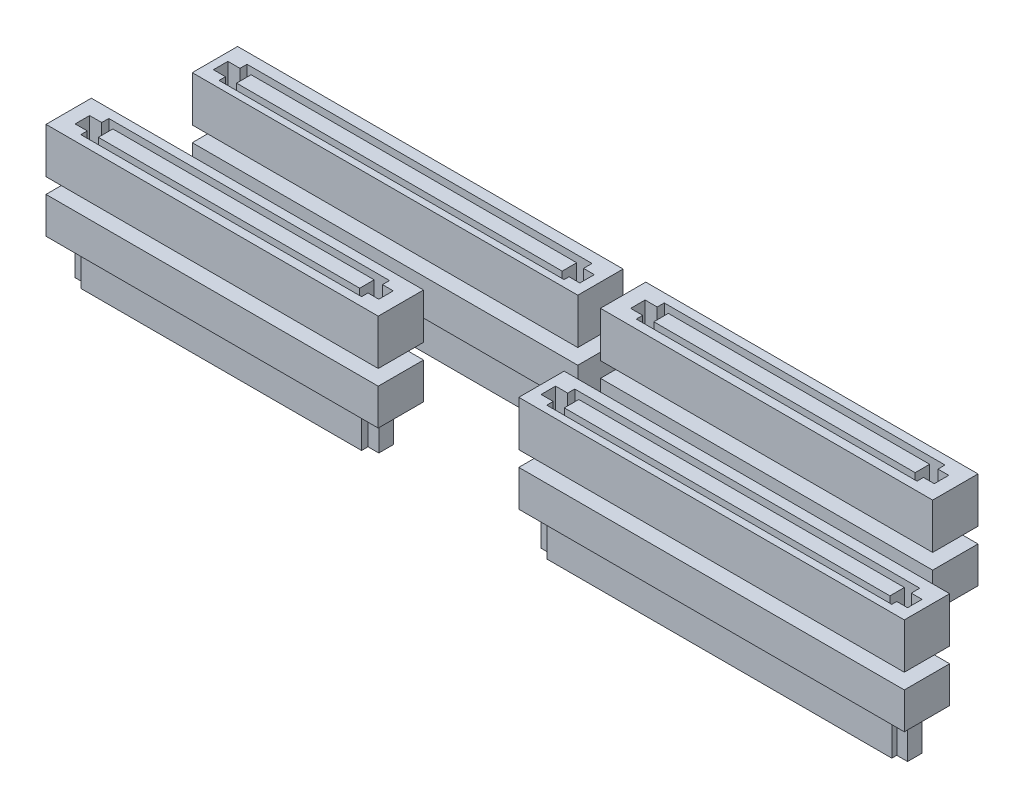
from build123d import *

# Parameters (mm, degrees)
SKETCH1_W          = 42.5
SKETCH1_H          = 5
SV4_DEPTH          = 5
SKETCH1_W_2        = 36.625
SV4_2_DEPTH        = 5
SV4_3_DEPTH        = 5
SV4_4_DEPTH        = 5
SKETCH3_W          = 28.811718275
SKETCH3_H          = 1.597828601
SKETCH3_W_2        = 35.897762959
SKETCH3_W_3        = 35.897762958
CUT_EXTRUDE1_DEPTH = 4
SKETCH6_W          = 42.5
SKETCH6_H          = 5
SV_A_DEPTH         = 4
SKETCH6_W_2        = 36.625
SV_A_2_DEPTH       = 4
SV_A_3_DEPTH       = 4
SV_A_4_DEPTH       = 4
SKETCH7_W          = 35.897762958
SKETCH7_H          = 1.597828601
SKETCH7_W_2        = 28.811718275
SKETCH7_W_3        = 35.897762959
SV_B_DEPTH         = 4


with BuildPart() as part:
    # Sketch1 → SV4 (new body)
    with BuildSketch(Plane(origin=(0, 0, 0), x_dir=(1, 0, 0), z_dir=(0, 1, 0))):
        with Locations((76, 7)):
            Rectangle(SKETCH1_W, SKETCH1_H)
    extrude(amount=SV4_DEPTH)


with BuildPart() as body_2:
    # Sketch1 → SV4 2 (new body)
    with BuildSketch(Plane(origin=(0, 0, 0), x_dir=(1, 0, 0), z_dir=(0, 1, 0))):
        with Locations((20.9375, 7)):
            Rectangle(SKETCH1_W_2, SKETCH1_H)
    extrude(amount=SV4_2_DEPTH)


with BuildPart() as body_3:
    # Sketch1 → SV4 3 (new body)
    with BuildSketch(Plane(origin=(0, 0, 0), x_dir=(1, 0, 0), z_dir=(0, 1, 0))):
        with Locations((69.0625, 20)):
            Rectangle(SKETCH1_W_2, SKETCH1_H)
    extrude(amount=SV4_3_DEPTH)


with BuildPart() as body_4:
    # Sketch1 → SV4 4 (new body)
    with BuildSketch(Plane(origin=(0, 0, 0), x_dir=(1, 0, 0), z_dir=(0, 1, 0))):
        with Locations((27, 20)):
            Rectangle(SKETCH1_W, SKETCH1_H)
    extrude(amount=SV4_4_DEPTH)


with BuildPart() as cut_extrude1_tool:
    # Sketch3 → Cut-Extrude1 (new body)
    # profile 1 of 4: a face of its own
    with BuildSketch(Plane(origin=(0, 5, 0), x_dir=(1, 0, 0), z_dir=(0, 1, 0))):
        Polygon((4.189336253, 7.745735487), (5.524337048, 7.745735487), (5.524337048, 8.524173538), (36.475691419, 8.524173538), (36.475691419, 7.745735487), (37.666991912, 7.745735487), (37.666991912, 6.147906886), (36.475691419, 6.147906886), (36.475691419, 5.438560322), (5.524337048, 5.438560322), (5.524337048, 6.147906886), (4.189336253, 6.147906886), align=None)
        with Locations((21.152985591, 6.946821187)):
            Rectangle(SKETCH3_W, SKETCH3_H, mode=Mode.SUBTRACT)
    # profile 2 of 4: a face of its own
    with BuildSketch(Plane(origin=(0, 5, 0), x_dir=(1, 0, 0), z_dir=(0, 1, 0))):
        Polygon((52.421116037, 20.753597434), (53.756116831, 20.753597434), (53.756116831, 21.532035485), (84.707471203, 21.532035485), (84.707471203, 20.753597434), (85.898771695, 20.753597434), (85.898771695, 19.155768833), (84.707471203, 19.155768833), (84.707471203, 18.446422269), (53.756116831, 18.446422269), (53.756116831, 19.155768833), (52.421116037, 19.155768833), align=None)
        with Locations((69.384765375, 19.954683133)):
            Rectangle(SKETCH3_W, SKETCH3_H, mode=Mode.SUBTRACT)
    # profile 3 of 4: a face of its own
    with BuildSketch(Plane(origin=(0, 5, 0), x_dir=(1, 0, 0), z_dir=(0, 1, 0))):
        Polygon((55.705906871, 7.599031898), (57.040907666, 7.599031898), (57.040907666, 8.377469948), (95.07830672, 8.377469948), (95.07830672, 7.437727621), (96.269607213, 7.437727621), (96.269607213, 5.83989902), (95.07830672, 5.83989902), (95.07830672, 5.291856733), (57.040907666, 5.291856733), (57.040907666, 6.001203297), (55.705906871, 6.001203297), align=None)
        with Locations((76.21257855, 6.800117597)):
            Rectangle(SKETCH3_W_2, SKETCH3_H, mode=Mode.SUBTRACT)
    # profile 4 of 4: a face of its own
    with BuildSketch(Plane(origin=(0, 5, 0), x_dir=(1, 0, 0), z_dir=(0, 1, 0))):
        Polygon((6.636601859, 20.53972103), (7.971602653, 20.53972103), (7.971602653, 21.318159081), (46.009001708, 21.318159081), (46.009001708, 20.378416754), (47.2003022, 20.378416754), (47.2003022, 18.780588153), (46.009001708, 18.780588153), (46.009001708, 18.232545866), (7.971602653, 18.232545866), (7.971602653, 18.941892429), (6.636601859, 18.941892429), align=None)
        with Locations((27.143273538, 19.74080673)):
            Rectangle(SKETCH3_W_3, SKETCH3_H, mode=Mode.SUBTRACT)
    extrude(amount=-CUT_EXTRUDE1_DEPTH)


with BuildPart() as part_1:
    add(part.part)

    # Cut-Extrude1: cut by cut_extrude1_tool
    add(cut_extrude1_tool.part, mode=Mode.SUBTRACT)


with BuildPart() as body_2_1:
    add(body_2.part)

    # Cut-Extrude1: cut by cut_extrude1_tool
    add(cut_extrude1_tool.part, mode=Mode.SUBTRACT)


with BuildPart() as body_3_1:
    add(body_3.part)

    # Cut-Extrude1: cut by cut_extrude1_tool
    add(cut_extrude1_tool.part, mode=Mode.SUBTRACT)


with BuildPart() as body_4_1:
    add(body_4.part)

    # Cut-Extrude1: cut by cut_extrude1_tool
    add(cut_extrude1_tool.part, mode=Mode.SUBTRACT)


with BuildPart() as body_5:
    # Sketch6 → SV(a) (new body)
    with BuildSketch(Plane(origin=(0, -1.68656, 0), x_dir=(1, 0, 0), z_dir=(0, 1, 0))):
        with Locations((27, 20)):
            Rectangle(SKETCH6_W, SKETCH6_H)
    extrude(amount=-SV_A_DEPTH)

    # Sketch7 → SV(b) (add)
    # profile 1 of 4: a face of its own
    with BuildSketch(Plane.XZ.offset(5.68656)):
        Polygon((7.971602653, -21.318159081), (7.971602653, -20.53972103), (6.636601859, -20.53972103), (6.636601859, -18.941892429), (7.971602653, -18.941892429), (7.971602653, -18.232545866), (46.009001708, -18.232545866), (46.009001708, -18.780588153), (47.2003022, -18.780588153), (47.2003022, -20.378416754), (46.009001708, -20.378416754), (46.009001708, -21.318159081), align=None)
        with Locations((27.143273538, -19.74080673)):
            Rectangle(SKETCH7_W, SKETCH7_H, mode=Mode.SUBTRACT)
    # profile 2 of 4: a face of its own
    with BuildSketch(Plane.XZ.offset(5.68656)):
        Polygon((53.756116831, -21.532035485), (84.707471203, -21.532035485), (84.707471203, -20.753597434), (85.898771695, -20.753597434), (85.898771695, -19.155768833), (84.707471203, -19.155768833), (84.707471203, -18.446422269), (53.756116831, -18.446422269), (53.756116831, -19.155768833), (52.421116037, -19.155768833), (52.421116037, -20.753597434), (53.756116831, -20.753597434), align=None)
        with Locations((69.384765375, -19.954683133)):
            Rectangle(SKETCH7_W_2, SKETCH7_H, mode=Mode.SUBTRACT)
    # profile 3 of 4: a face of its own
    with BuildSketch(Plane.XZ.offset(5.68656)):
        Polygon((57.040907666, -8.377469948), (57.040907666, -7.599031898), (55.705906871, -7.599031898), (55.705906871, -6.001203297), (57.040907666, -6.001203297), (57.040907666, -5.291856733), (95.07830672, -5.291856733), (95.07830672, -5.83989902), (96.269607213, -5.83989902), (96.269607213, -7.437727621), (95.07830672, -7.437727621), (95.07830672, -8.377469948), align=None)
        with Locations((76.21257855, -6.800117597)):
            Rectangle(SKETCH7_W_3, SKETCH7_H, mode=Mode.SUBTRACT)
    # profile 4 of 4: a face of its own
    with BuildSketch(Plane.XZ.offset(5.68656)):
        Polygon((4.189336253, -6.147906886), (5.524337048, -6.147906886), (5.524337048, -5.438560322), (36.475691419, -5.438560322), (36.475691419, -6.147906886), (37.666991912, -6.147906886), (37.666991912, -7.745735487), (36.475691419, -7.745735487), (36.475691419, -8.524173538), (5.524337048, -8.524173538), (5.524337048, -7.745735487), (4.189336253, -7.745735487), align=None)
        with Locations((21.152985591, -6.946821187)):
            Rectangle(SKETCH7_W_2, SKETCH7_H, mode=Mode.SUBTRACT)
    extrude(amount=SV_B_DEPTH)


with BuildPart() as body_6:
    # Sketch6 → SV_a 2 (new body)
    with BuildSketch(Plane(origin=(0, -1.68656, 0), x_dir=(1, 0, 0), z_dir=(0, 1, 0))):
        with Locations((69.0625, 20)):
            Rectangle(SKETCH6_W_2, SKETCH6_H)
    extrude(amount=-SV_A_2_DEPTH)


with BuildPart() as body_7:
    # Sketch6 → SV_a 3 (new body)
    with BuildSketch(Plane(origin=(0, -1.68656, 0), x_dir=(1, 0, 0), z_dir=(0, 1, 0))):
        with Locations((76, 7)):
            Rectangle(SKETCH6_W, SKETCH6_H)
    extrude(amount=-SV_A_3_DEPTH)


with BuildPart() as body_8:
    # Sketch6 → SV_a 4 (new body)
    with BuildSketch(Plane(origin=(0, -1.68656, 0), x_dir=(1, 0, 0), z_dir=(0, 1, 0))):
        with Locations((20.9375, 7)):
            Rectangle(SKETCH6_W_2, SKETCH6_H)
    extrude(amount=-SV_A_4_DEPTH)


with BuildPart() as sv_b_piece_1:
    # of the separate pieces the step leaves, piece 1, a body of its own (sv_b_pieces)
    add(body_5.part.solids().sort_by_distance((5.75, -1.68656, -22.5))[0])


with BuildPart() as sv_b_piece_2:
    # of the separate pieces the step leaves, piece 2, a body of its own (sv_b_pieces)
    add(body_5.part.solids().sort_by_distance((57.040907666, -5.68656, -8.377469948))[0])


with BuildPart() as sv_b_piece_3:
    # of the separate pieces the step leaves, piece 3, a body of its own (sv_b_pieces)
    add(body_5.part.solids().sort_by_distance((4.189336253, -5.68656, -6.147906886))[0])


with BuildPart() as sv_b_piece_4:
    # of the separate pieces the step leaves, piece 4, a body of its own (sv_b_pieces)
    add(body_5.part.solids().sort_by_distance((53.756116831, -5.68656, -21.532035485))[0])


solid = Compound([part_1.part, body_2_1.part, body_3_1.part, body_4_1.part, body_6.part, body_7.part, body_8.part, sv_b_piece_1.part, sv_b_piece_2.part, sv_b_piece_3.part, sv_b_piece_4.part])
